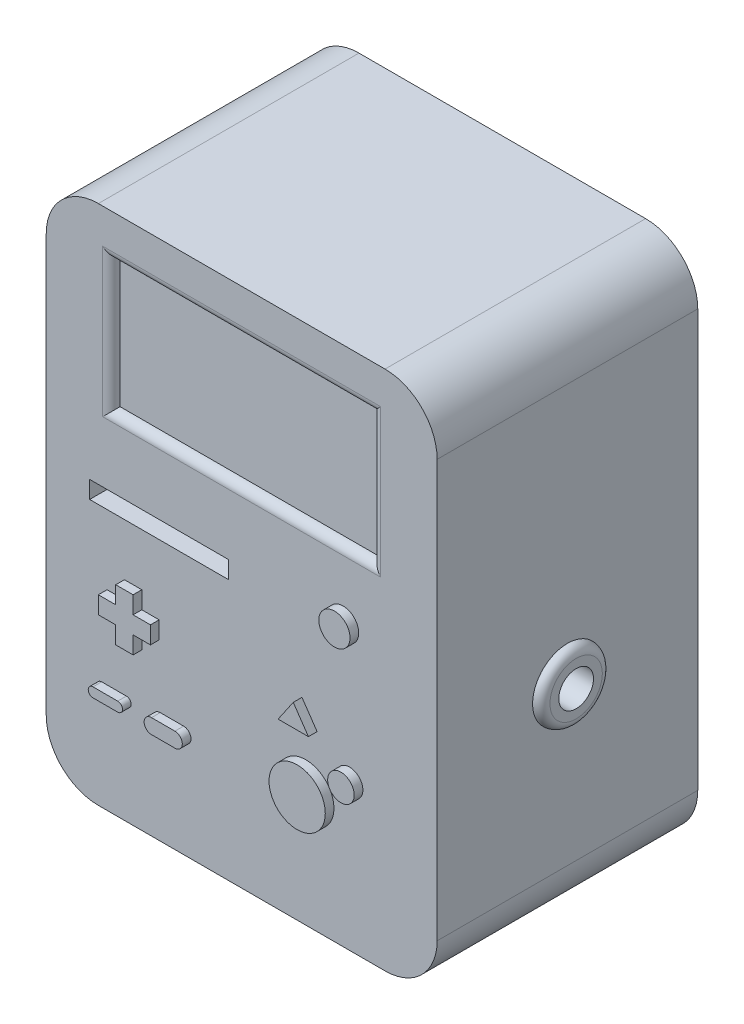
from build123d import *

# Parameters (mm, degrees)
SKETCH2_W           = 114.3
SKETCH2_H           = 76.2
BOSS_EXTRUDE1_DEPTH = 152.4
SKETCH3_W           = 76.2
SKETCH3_H           = 38.1
CUT_EXTRUDE1_DEPTH  = 2.54
FILLET2_R           = 15.24
SKETCH4_W           = 40.64
SKETCH4_H           = 5.08
CUT_EXTRUDE2_DEPTH  = 20.32
SKETCH5_R           = 4.562719015
BOSS_EXTRUDE2_DEPTH = 2.54
SKETCH11_R          = 10.195906114
BOSS_EXTRUDE3_DEPTH = 2.54
SKETCH12_R          = 5.08
CUT_EXTRUDE8_DEPTH  = 15.24
SKETCH13_R          = 6.35
CUT_EXTRUDE9_DEPTH  = 15.24
FILLET3_R           = 2.54
FILLET4_R           = 2.54
BOSS_EXTRUDE4_DEPTH = 2.54
BOSS_EXTRUDE5_DEPTH = 2.54
SKETCH8_R           = 3.879636345
BOSS_EXTRUDE6_DEPTH = 2.54
BOSS_EXTRUDE7_DEPTH = 2.54
SKETCH9_R           = 8.218720736
BOSS_EXTRUDE8_DEPTH = 2.54


with BuildPart() as part:
    # Sketch2 → Boss-Extrude1 (new body)
    with BuildSketch(Plane(origin=(0, 0, 0), x_dir=(1, 0, 0), z_dir=(0, 1, 0))):
        Rectangle(SKETCH2_W, SKETCH2_H)
    extrude(amount=BOSS_EXTRUDE1_DEPTH)

    # Sketch3 → Cut-Extrude1 (cut)
    with BuildSketch(Plane.XY.offset(38.1)):
        with Locations((0, 120.65)):
            Rectangle(SKETCH3_W, SKETCH3_H)
    extrude(amount=-CUT_EXTRUDE1_DEPTH, mode=Mode.SUBTRACT)

    # Fillet2
    fillet2_edges = [part.edges().sort_by_distance(p)[0] for p in [
        (-57.15, 152.4, 0),
        (57.15, 152.4, 0),
        (-57.15, 0, 0),
        (57.15, 0, 0),
    ]]
    fillet(fillet2_edges, radius=FILLET2_R)

    # Sketch4 → Cut-Extrude2 (cut)
    with BuildSketch(Plane.XY.offset(38.1)):
        with Locations((-24.13, 78.74)):
            Rectangle(SKETCH4_W, SKETCH4_H)
    extrude(amount=-CUT_EXTRUDE2_DEPTH, mode=Mode.SUBTRACT)

    # Sketch5 → Boss-Extrude2 (add)
    with BuildSketch(Plane.XY.offset(38.1)):
        with Locations(Location((29.657673596, 81.713285476, 0), (0, 0, 180))):
            Circle(SKETCH5_R)
    extrude(amount=BOSS_EXTRUDE2_DEPTH)

    # Sketch11 → Boss-Extrude3 (add)
    with BuildSketch(Plane.ZY.offset(57.15)):
        with Locations(Location((0, 61.307792105, 0), (0, 0, 180))):
            Circle(SKETCH11_R)
    boss_extrude3 = extrude(amount=BOSS_EXTRUDE3_DEPTH)

    # Sketch12 → Cut-Extrude8 (cut)
    with BuildSketch(Plane.ZY.offset(59.69)):
        with Locations((0, 61.307792105)):
            Circle(SKETCH12_R)
    cut_extrude8 = extrude(amount=-CUT_EXTRUDE8_DEPTH, mode=Mode.SUBTRACT)

    # Mirror1: Boss-Extrude3, Cut-Extrude8 across plane
    add(boss_extrude3.mirror(Plane(origin=(0, 0, 0), x_dir=(0, 0, 1), z_dir=(1, 0, 0))))
    add(cut_extrude8.mirror(Plane(origin=(0, 0, 0), x_dir=(0, 0, 1), z_dir=(1, 0, 0))), mode=Mode.SUBTRACT)

    # Sketch13 → Cut-Extrude9 (cut)
    with BuildSketch(Plane.XZ):
        with Locations(Location((-25.4, 0, 0), (0, 0, 270))):
            Circle(SKETCH13_R)
        with Locations(Location((25.4, 0, 0), (0, 0, 270))):
            Circle(SKETCH13_R)
    extrude(amount=-CUT_EXTRUDE9_DEPTH, mode=Mode.SUBTRACT)

    # Fillet3
    fillet3_edges = [part.edges().sort_by_distance(p)[0] for p in [
        (-59.69, 61.307792105, 10.195906114),
        (59.69, 61.307792105, 10.195906114),
    ]]
    fillet(fillet3_edges, radius=FILLET3_R - 0.0001)  # a hair under: the kernel refuses the full size

    # Fillet4
    fillet4_edges = [part.edges().sort_by_distance(p)[0] for p in [
        (0, 101.6, 38.1),
        (-38.1, 120.65, 38.1),
        (38.1, 120.65, 38.1),
        (0, 139.7, 38.1),
    ]]
    fillet(fillet4_edges, radius=FILLET4_R - 0.0001)  # a hair under: the kernel refuses the full size

    # Sketch6 → Boss-Extrude4 (add)
    with BuildSketch(Plane.XY.offset(38.1)):
        Polygon((-34.29, 60.96), (-34.29, 55.88), (-39.37, 55.88), (-39.37, 50.8), (-34.29, 50.8), (-34.29, 45.72), (-29.21, 45.72), (-29.21, 50.8), (-24.13, 50.8), (-24.13, 55.88), (-29.21, 55.88), (-29.21, 60.96), align=None)
    extrude(amount=BOSS_EXTRUDE4_DEPTH)

    # Sketch7 → Boss-Extrude5 (add)
    with BuildSketch(Plane.XY.offset(38.1)):
        Polygon((17.617165085, 57.125299675), (13.181188265, 50.661447737), (22.053141905, 50.661447737), align=None)
    extrude(amount=BOSS_EXTRUDE5_DEPTH)

    # Sketch8 → Boss-Extrude6 (add)
    with BuildSketch(Plane.XY.offset(38.1)):
        with Locations(Location((31.558806519, 42.549947266, 0), (0, 0, 180))):
            Circle(SKETCH8_R)
    extrude(amount=BOSS_EXTRUDE6_DEPTH)

    # Sketch10 → Boss-Extrude7 (add)
    with BuildSketch(Plane.XY.offset(38.1)):
        with BuildLine():
            Line((-40.937728938, 31.776860704), (-33.713423831, 31.776860704))
            ThreePointArc((-33.713423831, 31.776860704), (-32.319259688, 30.38269656), (-33.713423831, 28.988532417))
            Line((-33.713423831, 28.988532417), (-40.937728938, 28.988532417))
            ThreePointArc((-40.937728938, 28.988532417), (-42.331893081, 30.38269656), (-40.937728938, 31.776860704))
        make_face()
        with BuildLine():
            Line((-23.827532632, 32.537313873), (-16.98345411, 32.537313873))
            ThreePointArc((-16.98345411, 32.537313873), (-14.828836798, 30.38269656), (-16.98345411, 28.228079248))
            Line((-16.98345411, 28.228079248), (-23.827532632, 28.228079248))
            ThreePointArc((-23.827532632, 28.228079248), (-25.982149945, 30.38269656), (-23.827532632, 32.537313873))
        make_face()
    extrude(amount=BOSS_EXTRUDE7_DEPTH)

    # Sketch9 → Boss-Extrude8 (add)
    with BuildSketch(Plane.XY.offset(38.1)):
        with Locations(Location((18.757844838, 33.677993627, 0), (0, 0, 180))):
            Circle(SKETCH9_R)
    extrude(amount=BOSS_EXTRUDE8_DEPTH)


solid = part.part
